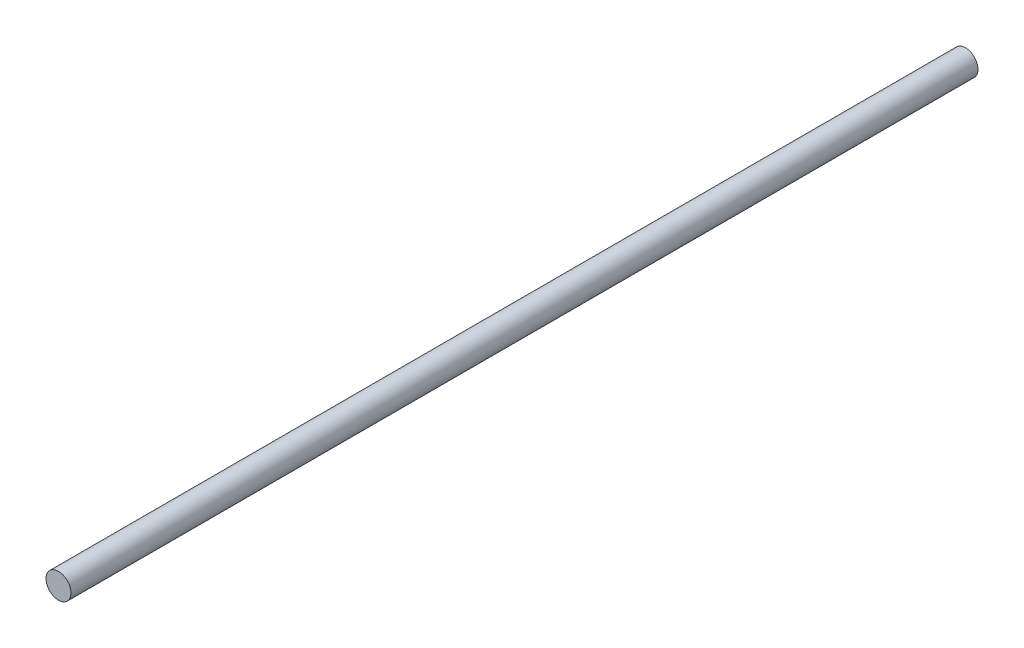
from build123d import *

# Parameters (mm, degrees)
SZKIC1_R                    = 4
DODANIE_WYCI_GNI_CIE1_DEPTH = 290.06


with BuildPart() as part:
    # Szkic1 → Dodanie-wyciągnięcie1 (new body)
    with BuildSketch(Plane.XY):
        Circle(SZKIC1_R)
    extrude(amount=DODANIE_WYCI_GNI_CIE1_DEPTH)


solid = part.part
